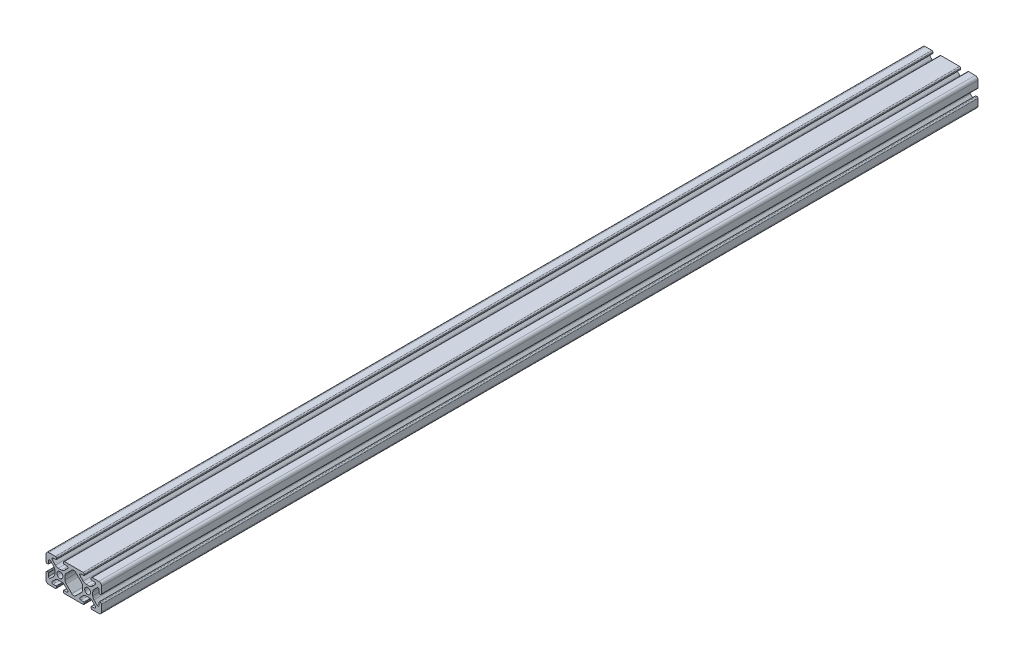
from build123d import *

# Parameters (mm, degrees)
ESQUISSE1_R        = 2.15
BOSS_EXTRU_1_DEPTH = 315.5


with BuildPart() as part:
    # Esquisse1 → Boss.-Extru.1 (new, symmetric)
    with BuildSketch(Plane(origin=(0, 0, 0), x_dir=(-1, 0, 0), z_dir=(0, 0, -1))):
        with BuildLine():
            Line((-40, 6.7), (-40, 2))
            ThreePointArc((-40, 2), (-39.414213562, 0.585786438), (-38, 0))
            Line((-38, 0), (-33.3, 0))
            ThreePointArc((-33.3, 0), (-32.734314575, 0.234314575), (-32.5, 0.8))
            Line((-32.5, 0.8), (-32.5, 1.5))
            ThreePointArc((-32.5, 1.5), (-32.587867966, 1.712132034), (-32.8, 1.8))
            Line((-32.8, 1.8), (-34.918424061, 1.8))
            ThreePointArc((-34.918424061, 1.8), (-35.686700051, 2.313345604), (-35.506437047, 3.219588924))
            Line((-35.506437047, 3.219588924), (-33.254705627, 5.471320344))
            ThreePointArc((-33.254705627, 5.471320344), (-32.281435581, 6.121638598), (-31.133385284, 6.35))
            Line((-31.133385284, 6.35), (-28.866614716, 6.35))
            ThreePointArc((-28.866614716, 6.35), (-27.718564419, 6.121638598), (-26.745294373, 5.471320344))
            Line((-26.745294373, 5.471320344), (-24.493562953, 3.219588924))
            ThreePointArc((-24.493562953, 3.219588924), (-24.313299949, 2.313345604), (-25.081575939, 1.8))
            Line((-25.081575939, 1.8), (-27.2, 1.8))
            ThreePointArc((-27.2, 1.8), (-27.412132034, 1.712132034), (-27.5, 1.5))
            Line((-27.5, 1.5), (-27.5, 0.8))
            ThreePointArc((-27.5, 0.8), (-27.265685425, 0.234314575), (-26.7, 0))
            Line((-26.7, 0), (-13.3, 0))
            ThreePointArc((-13.3, 0), (-12.734314575, 0.234314575), (-12.5, 0.8))
            Line((-12.5, 0.8), (-12.5, 1.5))
            ThreePointArc((-12.5, 1.5), (-12.587867966, 1.712132034), (-12.8, 1.8))
            Line((-12.8, 1.8), (-14.918424061, 1.8))
            ThreePointArc((-14.918424061, 1.8), (-15.686700051, 2.313345604), (-15.506437047, 3.219588924))
            Line((-15.506437047, 3.219588924), (-13.254705627, 5.471320344))
            ThreePointArc((-13.254705627, 5.471320344), (-12.281435581, 6.121638598), (-11.133385284, 6.35))
            Line((-11.133385284, 6.35), (-8.866614716, 6.35))
            ThreePointArc((-8.866614716, 6.35), (-7.718564419, 6.121638598), (-6.745294373, 5.471320344))
            Line((-6.745294373, 5.471320344), (-4.493562953, 3.219588924))
            ThreePointArc((-4.493562953, 3.219588924), (-4.313299949, 2.313345604), (-5.081575939, 1.8))
            Line((-5.081575939, 1.8), (-7.2, 1.8))
            ThreePointArc((-7.2, 1.8), (-7.412132034, 1.712132034), (-7.5, 1.5))
            Line((-7.5, 1.5), (-7.5, 0.8))
            ThreePointArc((-7.5, 0.8), (-7.265685425, 0.234314575), (-6.7, 0))
            Line((-6.7, 0), (-2, 0))
            ThreePointArc((-2, 0), (-0.585786438, 0.585786438), (0, 2))
            Line((0, 2), (0, 6.7))
            ThreePointArc((0, 6.7), (-0.234314575, 7.265685425), (-0.8, 7.5))
            Line((-0.8, 7.5), (-1.5, 7.5))
            ThreePointArc((-1.5, 7.5), (-1.712132034, 7.412132034), (-1.8, 7.2))
            Line((-1.8, 7.2), (-1.8, 5.081575939))
            ThreePointArc((-1.8, 5.081575939), (-2.313345604, 4.313299949), (-3.219588924, 4.493562953))
            Line((-3.219588924, 4.493562953), (-5.471320344, 6.745294373))
            ThreePointArc((-5.471320344, 6.745294373), (-6.121638598, 7.718564419), (-6.35, 8.866614716))
            Line((-6.35, 8.866614716), (-6.35, 11.133385284))
            ThreePointArc((-6.35, 11.133385284), (-6.121638598, 12.281435581), (-5.471320344, 13.254705627))
            Line((-5.471320344, 13.254705627), (-3.219588924, 15.506437047))
            ThreePointArc((-3.219588924, 15.506437047), (-2.313345604, 15.686700051), (-1.8, 14.918424061))
            Line((-1.8, 14.918424061), (-1.8, 12.8))
            ThreePointArc((-1.8, 12.8), (-1.712132034, 12.587867966), (-1.5, 12.5))
            Line((-1.5, 12.5), (-0.8, 12.5))
            ThreePointArc((-0.8, 12.5), (-0.234314575, 12.734314575), (0, 13.3))
            Line((0, 13.3), (0, 18))
            ThreePointArc((0, 18), (-0.585786438, 19.414213562), (-2, 20))
            Line((-2, 20), (-6.7, 20))
            ThreePointArc((-6.7, 20), (-7.265685425, 19.765685425), (-7.5, 19.2))
            Line((-7.5, 19.2), (-7.5, 18.5))
            ThreePointArc((-7.5, 18.5), (-7.412132034, 18.287867966), (-7.2, 18.2))
            Line((-7.2, 18.2), (-5.081575939, 18.2))
            ThreePointArc((-5.081575939, 18.2), (-4.313299949, 17.686654396), (-4.493562953, 16.780411076))
            Line((-4.493562953, 16.780411076), (-6.745294373, 14.528679656))
            ThreePointArc((-6.745294373, 14.528679656), (-7.718564419, 13.878361402), (-8.866614716, 13.65))
            Line((-8.866614716, 13.65), (-11.133385284, 13.65))
            ThreePointArc((-11.133385284, 13.65), (-12.281435581, 13.878361402), (-13.254705627, 14.528679656))
            Line((-13.254705627, 14.528679656), (-15.506437047, 16.780411076))
            ThreePointArc((-15.506437047, 16.780411076), (-15.686700051, 17.686654396), (-14.918424061, 18.2))
            Line((-14.918424061, 18.2), (-12.8, 18.2))
            ThreePointArc((-12.8, 18.2), (-12.587867966, 18.287867966), (-12.5, 18.5))
            Line((-12.5, 18.5), (-12.5, 19.2))
            ThreePointArc((-12.5, 19.2), (-12.734314575, 19.765685425), (-13.3, 20))
            Line((-13.3, 20), (-26.7, 20))
            ThreePointArc((-26.7, 20), (-27.265685425, 19.765685425), (-27.5, 19.2))
            Line((-27.5, 19.2), (-27.5, 18.5))
            ThreePointArc((-27.5, 18.5), (-27.412132034, 18.287867966), (-27.2, 18.2))
            Line((-27.2, 18.2), (-25.081575939, 18.2))
            ThreePointArc((-25.081575939, 18.2), (-24.313299949, 17.686654396), (-24.493562953, 16.780411076))
            Line((-24.493562953, 16.780411076), (-26.745294373, 14.528679656))
            ThreePointArc((-26.745294373, 14.528679656), (-27.718564419, 13.878361402), (-28.866614716, 13.65))
            Line((-28.866614716, 13.65), (-31.133385284, 13.65))
            ThreePointArc((-31.133385284, 13.65), (-32.281435581, 13.878361402), (-33.254705627, 14.528679656))
            Line((-33.254705627, 14.528679656), (-35.506437047, 16.780411076))
            ThreePointArc((-35.506437047, 16.780411076), (-35.686700051, 17.686654396), (-34.918424061, 18.2))
            Line((-34.918424061, 18.2), (-32.8, 18.2))
            ThreePointArc((-32.8, 18.2), (-32.587867966, 18.287867966), (-32.5, 18.5))
            Line((-32.5, 18.5), (-32.5, 19.2))
            ThreePointArc((-32.5, 19.2), (-32.734314575, 19.765685425), (-33.3, 20))
            Line((-33.3, 20), (-38, 20))
            ThreePointArc((-38, 20), (-39.414213562, 19.414213562), (-40, 18))
            Line((-40, 18), (-40, 13.3))
            ThreePointArc((-40, 13.3), (-39.765685425, 12.734314575), (-39.2, 12.5))
            Line((-39.2, 12.5), (-38.5, 12.5))
            ThreePointArc((-38.5, 12.5), (-38.287867966, 12.587867966), (-38.2, 12.8))
            Line((-38.2, 12.8), (-38.2, 14.918424061))
            ThreePointArc((-38.2, 14.918424061), (-37.686654396, 15.686700051), (-36.780411076, 15.506437047))
            Line((-36.780411076, 15.506437047), (-34.528679656, 13.254705627))
            ThreePointArc((-34.528679656, 13.254705627), (-33.878361402, 12.281435581), (-33.65, 11.133385284))
            Line((-33.65, 11.133385284), (-33.65, 8.866614716))
            ThreePointArc((-33.65, 8.866614716), (-33.878361402, 7.718564419), (-34.528679656, 6.745294373))
            Line((-34.528679656, 6.745294373), (-36.780411076, 4.493562953))
            ThreePointArc((-36.780411076, 4.493562953), (-37.686654396, 4.313299949), (-38.2, 5.081575939))
            Line((-38.2, 5.081575939), (-38.2, 7.2))
            ThreePointArc((-38.2, 7.2), (-38.287867966, 7.412132034), (-38.5, 7.5))
            Line((-38.5, 7.5), (-39.2, 7.5))
            ThreePointArc((-39.2, 7.5), (-39.765685425, 7.265685425), (-40, 6.7))
        make_face()
        with Locations((-10, 10)):
            Circle(ESQUISSE1_R, mode=Mode.SUBTRACT)
        with Locations((-30, 10)):
            Circle(ESQUISSE1_R, mode=Mode.SUBTRACT)
        with BuildLine():
            Line((-18.585786174, 17.312993861), (-14.528681072, 13.255889759))
            ThreePointArc((-14.528681072, 13.255889759), (-13.878362627, 12.282619622), (-13.650001154, 11.134569154))
            Line((-13.650001154, 11.134569154), (-13.650001154, 8.865431094))
            ThreePointArc((-13.650001154, 8.865431094), (-13.878362476, 7.717381202), (-14.5286805, 6.7441115))
            Line((-14.5286805, 6.7441115), (-18.585786, 2.687006))
            ThreePointArc((-18.585786, 2.687006), (-19.999999562, 2.101219562), (-21.414213125, 2.687006))
            Line((-21.414213125, 2.687006), (-25.471320125, 6.744113))
            ThreePointArc((-25.471320125, 6.744113), (-26.121638379, 7.717383046), (-26.349999781, 8.865433344))
            Line((-26.349999781, 8.865433344), (-26.349999781, 11.134567344))
            ThreePointArc((-26.349999781, 11.134567344), (-26.121638308, 12.282617811), (-25.471319863, 13.255887949))
            Line((-25.471319863, 13.255887949), (-21.41421295, 17.312993861))
            ThreePointArc((-21.41421295, 17.312993861), (-19.999999562, 17.898780125), (-18.585786174, 17.312993861))
        make_face(mode=Mode.SUBTRACT)
    extrude(amount=BOSS_EXTRU_1_DEPTH, both=True)


solid = part.part
